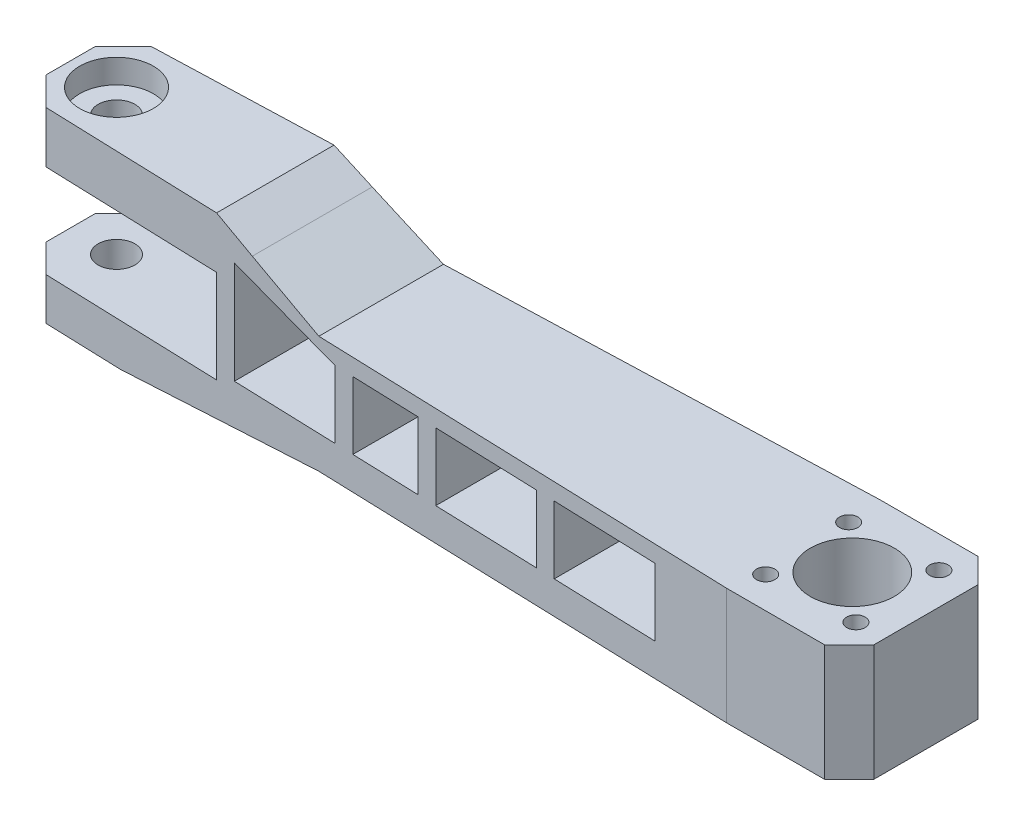
from build123d import *

# Parameters (mm, degrees)
SKETCH1_R           = 1.5
SKETCH1_R_2         = 3
SKETCH1_R_3         = 6.85
BOSS_EXTRUDE1_DEPTH = 30.5
CUT_EXTRUDE1_START  = 30.5
SKETCH1_3_R         = 6
CUT_EXTRUDE1_DEPTH  = 3.9
SKETCH1_4_R         = 7.8
CUT_EXTRUDE2_DEPTH  = 0.75
CUT_EXTRUDE3_START  = 30.5
SKETCH1_5_R         = 7.8
CUT_EXTRUDE3_DEPTH  = 1.5
SKETCH3_W           = 33.4
SKETCH3_H           = 15.2
CUT_EXTRUDE4_DEPTH  = 25
SKETCH4_W           = 11
SKETCH4_H           = 11
SKETCH4_W_2         = 17
CUT_EXTRUDE5_DEPTH  = 25
CUT_EXTRUDE6_START  = 20
SKETCH4_3_W         = 17
SKETCH4_3_H         = 11
CUT_EXTRUDE6_DEPTH  = 30


with BuildPart() as part:
    # Sketch1 → Boss-Extrude1 (new body)
    with BuildSketch(Plane(origin=(0, 0, 0), x_dir=(1, 0, 0), z_dir=(0, 1, 0))):
        Polygon((78.243154436, -8.5), (78.243154436, 8.5), (74.240930054, 12.502224382), (58.240930054, 12.502224382), (-56.660651486, 8.596194078), (-61.256845564, 4), (-61.256845564, -4), (-56.660651486, -8.596194078), (58.240930054, -12.502224382), (74.240930054, -12.502224382), align=None)
        with Locations((59.47311011, -7.359789388)):
            Circle(SKETCH1_R, mode=Mode.SUBTRACT)
        with Locations((73.602943824, -6.770044326)):
            Circle(SKETCH1_R, mode=Mode.SUBTRACT)
        with Locations((58.883365048, 6.770044326)):
            Circle(SKETCH1_R, mode=Mode.SUBTRACT)
        with Locations((73.013198761, 7.359789388)):
            Circle(SKETCH1_R, mode=Mode.SUBTRACT)
        with Locations((-53.756845564, 0)):
            Circle(SKETCH1_R_2, mode=Mode.SUBTRACT)
        with Locations((66.243154436, 0)):
            Circle(SKETCH1_R_3, mode=Mode.SUBTRACT)
    extrude(amount=BOSS_EXTRUDE1_DEPTH)

    # Sketch1<3> → Cut-Extrude1 (cut)
    with BuildSketch(Plane(origin=(0, 0, 0), x_dir=(1, 0, 0), z_dir=(0, 1, 0)).offset(CUT_EXTRUDE1_START)):
        with Locations((-53.756845564, 0)):
            Circle(SKETCH1_3_R)
    extrude(amount=-CUT_EXTRUDE1_DEPTH, mode=Mode.SUBTRACT)

    # Sketch1<4> → Cut-Extrude2 (cut, symmetric)
    with BuildSketch(Plane(origin=(0, 0, 0), x_dir=(1, 0, 0), z_dir=(0, 1, 0))):
        with Locations((66.243154436, 0)):
            Circle(SKETCH1_4_R)
    extrude(amount=CUT_EXTRUDE2_DEPTH, both=True, mode=Mode.SUBTRACT)

    # Sketch1<5> → Cut-Extrude3 (cut)
    with BuildSketch(Plane(origin=(0, 0, 0), x_dir=(1, 0, 0), z_dir=(0, 1, 0)).offset(CUT_EXTRUDE3_START)):
        with Locations((66.243154436, 0)):
            Circle(SKETCH1_5_R)
    extrude(amount=-CUT_EXTRUDE3_DEPTH, mode=Mode.SUBTRACT)

    # Sketch3 → Cut-Extrude4 (cut, symmetric)
    with BuildSketch(Plane.XY):
        with Locations((-44.556845564, 14.5)):
            Rectangle(SKETCH3_W, SKETCH3_H)
        Polygon((78.243154436, 0), (78.243154436, 3), (-10.596845564, 2.929436477), (-44.080457712, 0), (9.374237964, -19.733731398), align=None)
        Polygon((-10.596845564, 22), (78.243154436, 22), (78.243154436, 30.5), (39.447370773, 56.936233567), (-27.856845564, 30.5), (-21.831878362, 27.5), align=None)
    extrude(amount=CUT_EXTRUDE4_DEPTH, both=True, mode=Mode.SUBTRACT)

    # Sketch4 → Cut-Extrude5 (cut, symmetric)
    with BuildSketch(Plane.XY):
        Polygon((-24.856845564, 24.991492085), (-24.856845564, 8.276006159), (-7.856845564, 8.276006159), (-7.856845564, 19.276006159), align=None)
        with Locations((0.643154436, 13.776006159)):
            Rectangle(SKETCH4_W, SKETCH4_H)
        with Locations((17.643154436, 13.776006159)):
            Rectangle(SKETCH4_W_2, SKETCH4_H)
    extrude(amount=CUT_EXTRUDE5_DEPTH, both=True, mode=Mode.SUBTRACT)

    # Sketch4<3> → Cut-Extrude6 (cut)
    with BuildSketch(Plane.XY.offset(CUT_EXTRUDE6_START)):
        with Locations((37.643154436, 13.776006159)):
            Rectangle(SKETCH4_3_W, SKETCH4_3_H)
    extrude(amount=-CUT_EXTRUDE6_DEPTH, mode=Mode.SUBTRACT)


solid = part.part
